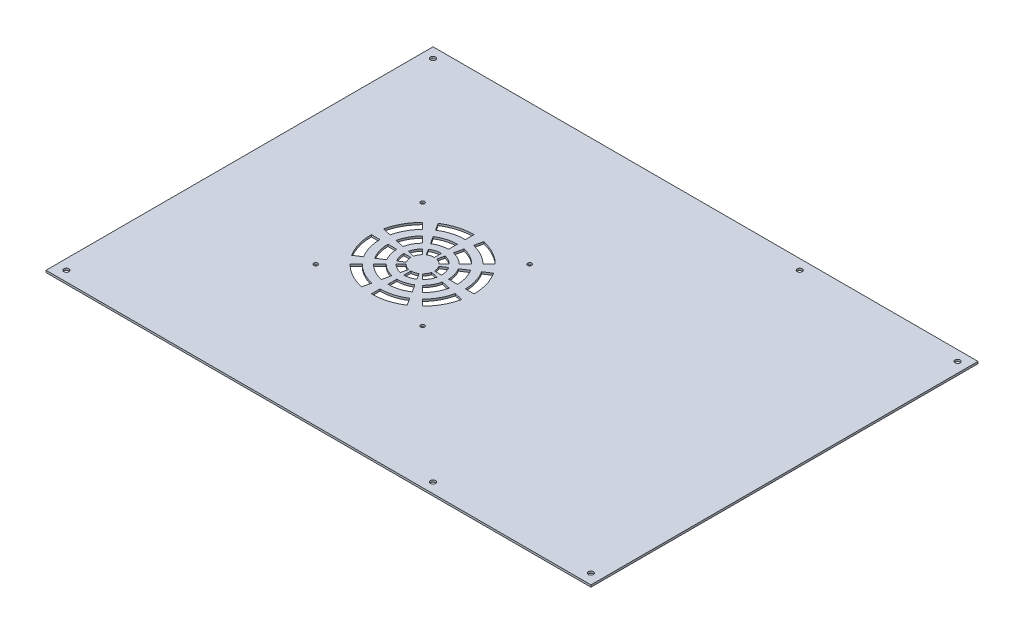
from build123d import *

# Parameters (mm, degrees)
SKICA1_W                 = 535
SKICA1_H                 = 380
SKICA1_R                 = 2.5
P_IDAT_VYSUNUT_M1_DEPTH  = 2
SKICA2_R                 = 2
ODEBRAT_VYSUNUT_M1_DEPTH = 2


with BuildPart() as part:
    # Skica1 → Přidat vysunutím1 (new body)
    with BuildSketch(Plane(origin=(0, 0, 0), x_dir=(1, 0, 0), z_dir=(0, 1, 0))):
        Rectangle(SKICA1_W, SKICA1_H)
        with Locations((-257.529345711, 180)):
            Circle(SKICA1_R, mode=Mode.SUBTRACT)
        with Locations((-257.5, -180)):
            Circle(SKICA1_R, mode=Mode.SUBTRACT)
        with Locations((102.5, -180)):
            Circle(SKICA1_R, mode=Mode.SUBTRACT)
        with Locations((257.5, -180)):
            Circle(SKICA1_R, mode=Mode.SUBTRACT)
        with Locations((102.5, 180)):
            Circle(SKICA1_R, mode=Mode.SUBTRACT)
        with Locations((257.5, 180)):
            Circle(SKICA1_R, mode=Mode.SUBTRACT)
    extrude(amount=P_IDAT_VYSUNUT_M1_DEPTH)

    # Skica2 → Odebrat vysunutím1 (cut)
    with BuildSketch(Plane(origin=(0, 2, 0), x_dir=(1, 0, 0), z_dir=(0, 1, 0))):
        with BuildLine():
            ThreePointArc((-78.00927381, 6.220124283), (-76.65105988, 3.240949712), (-76.185795255, 0))
            Line((-76.185795255, 0), (-69.243220908, 0))
            ThreePointArc((-69.243220908, 0), (-69.988865289, 5.194024669), (-72.165571898, 9.968522144))
            Line((-72.165571898, 9.968522144), (-78.00927381, 6.220124283))
        make_face()
        with BuildLine():
            Line((-69.668554916, -3.94018988), (-76.451193711, -2.458586177))
            ThreePointArc((-76.451193711, -2.458586177), (-77.597385973, -5.525582999), (-79.56009172, -8.146272289))
            Line((-79.56009172, -8.146272289), (-74.65095032, -13.055413689))
            ThreePointArc((-74.65095032, -13.055413689), (-71.505470453, -8.855433426), (-69.668554916, -3.94018988))
        make_face()
        with BuildLine():
            Line((-77.737841865, -15.54079211), (-81.486239726, -9.697090199))
            ThreePointArc((-81.486239726, -9.697090199), (-84.465414297, -11.055304129), (-87.706364009, -11.520568754))
            Line((-87.706364009, -11.520568754), (-87.706364009, -18.463143101))
            ThreePointArc((-87.706364009, -18.463143101), (-82.51233934, -17.71749872), (-77.737841865, -15.54079211))
        make_face()
        with BuildLine():
            Line((-91.646553889, -18.037809093), (-90.164950186, -11.255170297))
            ThreePointArc((-90.164950186, -11.255170297), (-93.231947008, -10.108978036), (-95.852636298, -8.146272289))
            Line((-95.852636298, -8.146272289), (-100.761777697, -13.055413689))
            ThreePointArc((-100.761777697, -13.055413689), (-96.561797434, -16.200893556), (-91.646553889, -18.037809093))
        make_face()
        with BuildLine():
            Line((-103.247156119, -9.968522144), (-97.403454207, -6.220124283))
            ThreePointArc((-97.403454207, -6.220124283), (-98.761668137, -3.240949712), (-99.226932762, 0))
            Line((-99.226932762, 0), (-106.169507109, 0))
            ThreePointArc((-106.169507109, 0), (-105.423862729, -5.194024669), (-103.247156119, -9.968522144))
        make_face()
        with BuildLine():
            Line((-105.744173102, 3.94018988), (-98.961534306, 2.458586177))
            ThreePointArc((-98.961534306, 2.458586177), (-97.815342045, 5.525582999), (-95.852636298, 8.146272289))
            Line((-95.852636298, 8.146272289), (-100.761777697, 13.055413689))
            ThreePointArc((-100.761777697, 13.055413689), (-103.907257564, 8.855433426), (-105.744173102, 3.94018988))
        make_face()
        with BuildLine():
            Line((-97.674886153, 15.54079211), (-93.926488291, 9.697090199))
            ThreePointArc((-93.926488291, 9.697090199), (-90.94731372, 11.055304129), (-87.706364009, 11.520568754))
            Line((-87.706364009, 11.520568754), (-87.706364009, 18.463143101))
            ThreePointArc((-87.706364009, 18.463143101), (-92.900388678, 17.71749872), (-97.674886153, 15.54079211))
        make_face()
        with BuildLine():
            Line((-83.766174129, 18.037809093), (-85.247777832, 11.255170297))
            ThreePointArc((-85.247777832, 11.255170297), (-82.18078101, 10.108978036), (-79.56009172, 8.146272289))
            Line((-79.56009172, 8.146272289), (-74.65095032, 13.055413689))
            ThreePointArc((-74.65095032, 13.055413689), (-78.850930583, 16.200893556), (-83.766174129, 18.037809093))
        make_face()
        with BuildLine():
            ThreePointArc((-66.371324511, 13.685197779), (-63.383052024, 7.130570995), (-62.359400707, 0))
            Line((-62.359400707, 0), (-53.602426896, 0))
            ThreePointArc((-53.602426896, 0), (-54.979733508, 9.594070181), (-59.000406744, 18.413216561))
            Line((-59.000406744, 18.413216561), (-66.371324511, 13.685197779))
        make_face()
        with BuildLine():
            Line((-54.388076673, -7.278066748), (-62.943316752, -5.409254954))
            ThreePointArc((-62.943316752, -5.409254954), (-65.465110059, -12.157103741), (-69.783354376, -17.923009633))
            Line((-69.783354376, -17.923009633), (-63.591238811, -24.115125197))
            ThreePointArc((-63.591238811, -24.115125197), (-57.781109572, -16.357190268), (-54.388076673, -7.278066748))
        make_face()
        with BuildLine():
            Line((-69.293147448, -28.705957264), (-74.02116623, -21.335039497))
            ThreePointArc((-74.02116623, -21.335039497), (-80.575793014, -24.323311984), (-87.706364009, -25.346963301))
            Line((-87.706364009, -25.346963301), (-87.706364009, -34.103937113))
            ThreePointArc((-87.706364009, -34.103937113), (-78.112293828, -32.726630501), (-69.293147448, -28.705957264))
        make_face()
        with BuildLine():
            Line((-94.984430757, -33.318287336), (-93.115618963, -24.763047257))
            ThreePointArc((-93.115618963, -24.763047257), (-99.863467749, -22.241253949), (-105.629373642, -17.923009633))
            Line((-105.629373642, -17.923009633), (-111.821489206, -24.115125197))
            ThreePointArc((-111.821489206, -24.115125197), (-104.063554277, -29.925254437), (-94.984430757, -33.318287336))
        make_face()
        with BuildLine():
            Line((-116.412321273, -18.413216561), (-109.041403506, -13.685197779))
            ThreePointArc((-109.041403506, -13.685197779), (-112.029675993, -7.130570995), (-113.05332731, 0))
            Line((-113.05332731, 0), (-121.810301121, 0))
            ThreePointArc((-121.810301121, 0), (-120.432994509, -9.594070181), (-116.412321273, -18.413216561))
        make_face()
        with BuildLine():
            Line((-121.024651344, 7.278066748), (-112.469411265, 5.409254954))
            ThreePointArc((-112.469411265, 5.409254954), (-109.947617958, 12.157103741), (-105.629373642, 17.923009633))
            Line((-105.629373642, 17.923009633), (-111.821489206, 24.115125197))
            ThreePointArc((-111.821489206, 24.115125197), (-117.631618445, 16.357190268), (-121.024651344, 7.278066748))
        make_face()
        with BuildLine():
            Line((-106.119580569, 28.705957264), (-101.391561788, 21.335039497))
            ThreePointArc((-101.391561788, 21.335039497), (-94.836935004, 24.323311984), (-87.706364009, 25.346963301))
            Line((-87.706364009, 25.346963301), (-87.706364009, 34.103937113))
            ThreePointArc((-87.706364009, 34.103937113), (-97.30043419, 32.726630501), (-106.119580569, 28.705957264))
        make_face()
        with BuildLine():
            Line((-80.42829726, 33.318287336), (-82.297109055, 24.763047257))
            ThreePointArc((-82.297109055, 24.763047257), (-75.549260268, 22.241253949), (-69.783354376, 17.923009633))
            Line((-69.783354376, 17.923009633), (-63.591238811, 24.115125197))
            ThreePointArc((-63.591238811, 24.115125197), (-71.34917374, 29.925254437), (-80.42829726, 33.318287336))
        make_face()
        with BuildLine():
            ThreePointArc((-52.430226431, 22.627608432), (-47.489306992, 11.789947868), (-45.796764323, 0))
            Line((-45.796764323, 0), (-37.287132287, 0))
            ThreePointArc((-37.287132287, 0), (-39.323341215, 14.183865224), (-45.26750112, 27.222083757))
            Line((-45.26750112, 27.222083757), (-52.430226431, 22.627608432))
        make_face()
        with BuildLine():
            Line((-38.448636251, -10.759887712), (-46.762232549, -8.943860731))
            ThreePointArc((-46.762232549, -8.943860731), (-50.931858186, -20.101001649), (-58.071801874, -29.634562134))
            Line((-58.071801874, -29.634562134), (-52.054583356, -35.651780653))
            ThreePointArc((-52.054583356, -35.651780653), (-43.464893213, -24.182456229), (-38.448636251, -10.759887712))
        make_face()
        with BuildLine():
            Line((-60.484280252, -42.438862889), (-65.078755576, -35.276137578))
            ThreePointArc((-65.078755576, -35.276137578), (-75.916416141, -40.217057016), (-87.706364009, -41.909599685))
            Line((-87.706364009, -41.909599685), (-87.706364009, -50.419231722))
            ThreePointArc((-87.706364009, -50.419231722), (-73.522498785, -48.383022794), (-60.484280252, -42.438862889))
        make_face()
        with BuildLine():
            Line((-98.466251721, -49.257727757), (-96.65022474, -40.94413146))
            ThreePointArc((-96.65022474, -40.94413146), (-107.807365657, -36.774505823), (-117.340926143, -29.634562134))
            Line((-117.340926143, -29.634562134), (-123.358144661, -35.651780653))
            ThreePointArc((-123.358144661, -35.651780653), (-111.888820237, -44.241470795), (-98.466251721, -49.257727757))
        make_face()
        with BuildLine():
            Line((-130.145226898, -27.222083757), (-122.982501587, -22.627608432))
            ThreePointArc((-122.982501587, -22.627608432), (-127.923421025, -11.789947868), (-129.615963694, 0))
            Line((-129.615963694, 0), (-138.12559573, 0))
            ThreePointArc((-138.12559573, 0), (-136.089386803, -14.183865224), (-130.145226898, -27.222083757))
        make_face()
        with BuildLine():
            Line((-136.964091766, 10.759887712), (-128.650495469, 8.943860731))
            ThreePointArc((-128.650495469, 8.943860731), (-124.480869831, 20.101001649), (-117.340926143, 29.634562134))
            Line((-117.340926143, 29.634562134), (-123.358144661, 35.651780653))
            ThreePointArc((-123.358144661, 35.651780653), (-131.947834804, 24.182456229), (-136.964091766, 10.759887712))
        make_face()
        with BuildLine():
            Line((-114.928447766, 42.438862889), (-110.333972441, 35.276137578))
            ThreePointArc((-110.333972441, 35.276137578), (-99.496311876, 40.217057016), (-87.706364009, 41.909599685))
            Line((-87.706364009, 41.909599685), (-87.706364009, 50.419231722))
            ThreePointArc((-87.706364009, 50.419231722), (-101.890229233, 48.383022794), (-114.928447766, 42.438862889))
        make_face()
        with BuildLine():
            Line((-76.946476296, 49.257727757), (-78.762503278, 40.94413146))
            ThreePointArc((-78.762503278, 40.94413146), (-67.60536236, 36.774505823), (-58.071801874, 29.634562134))
            Line((-58.071801874, 29.634562134), (-52.054583356, 35.651780653))
            ThreePointArc((-52.054583356, 35.651780653), (-63.52390778, 44.241470795), (-76.946476296, 49.257727757))
        make_face()
        with Locations((-140.206364009, 52.5)):
            Circle(SKICA2_R)
        with Locations((-35.206364009, 52.5)):
            Circle(SKICA2_R)
        with Locations((-140.206364009, -52.5)):
            Circle(SKICA2_R)
        with Locations((-35.206364009, -52.5)):
            Circle(SKICA2_R)
    extrude(amount=-ODEBRAT_VYSUNUT_M1_DEPTH, mode=Mode.SUBTRACT)


solid = part.part
